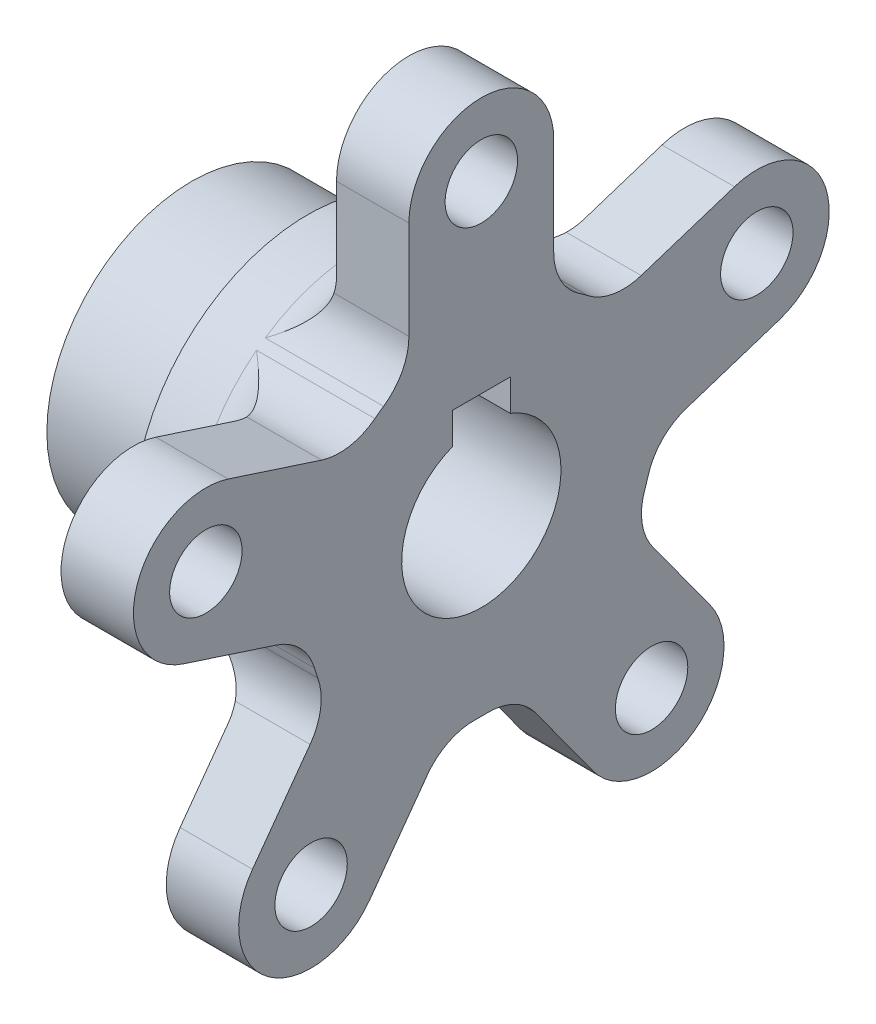
from build123d import *

# Parameters (mm, degrees)
SKETCH1_R                = 10
BOSS_EXTRUDE2_DEPTH      = 20
SKETCH5_R                = 12
BOSS_EXTRUDE3_DEPTH      = 12
BOSS_EXTRUDE4_DEPTH      = 5
FILLET2_R                = 3.175
F_5_0_5_DIAMETER_HOLE1_D = 5
FILLET1_START            = 15.0000001
FILLET1_DEPTH            = 4.9999999
FILLET1_START_2          = 11.8249999
FILLET1_2_DEPTH          = 3.1750001
CIRPATTERN6_START        = 11.8249999
CIRPATTERN6_OUTLINE_R    = 2.5
CIRPATTERN6_DEPTH        = 8.1750001
SKETCH2_R                = 5.5
SHAFT_HOLE_DEPTH         = 41.025175904
SKETCH3_W                = 4
SKETCH3_H                = 3.6
KEYWAY_DEPTH             = 41.025175904


with BuildPart() as part:
    # Sketch1 → Boss-Extrude2 (new body)
    with BuildSketch(Plane(origin=(0, 0, 0), x_dir=(0, 0, -1), z_dir=(1, 0, 0))):
        Circle(SKETCH1_R)
    extrude(amount=BOSS_EXTRUDE2_DEPTH)

    # Sketch5 → Boss-Extrude3 (add)
    with BuildSketch(Plane.ZY.offset(-20)):
        Circle(SKETCH5_R)
    extrude(amount=BOSS_EXTRUDE3_DEPTH)

    # Sketch6 → Boss-Extrude4 (add)
    with BuildSketch(Plane(origin=(20, 0, 0), x_dir=(0, 0, -1), z_dir=(1, 0, 0))):
        with BuildLine():
            Line((-5, 20), (-5, 0))
            Line((-5, 0), (5, 0))
            Line((5, 0), (5, 20))
            ThreePointArc((5, 20), (0, 25), (-5, 20))
        make_face()
    extrude(amount=-BOSS_EXTRUDE4_DEPTH)

    # Fillet2
    fillet2_edges = [part.edges().sort_by_distance(p)[0] for p in [
        (15, 12, 0),
    ]]
    fillet(fillet2_edges, radius=FILLET2_R)

    # Ø5.0 (5) Diameter Hole1 (through all)
    with Locations(Plane(origin=(20, 0, 0), x_dir=(0, 0, -1), z_dir=(1, 0, 0))):
        with Locations((0, 20)):
            Hole(F_5_0_5_DIAMETER_HOLE1_D / 2)

    # Fillet1: read off the stored shape, not the designer's step
    # Fillet1 outline → Fillet1 (add)
    with BuildSketch(Plane.YZ.offset(FILLET1_START)):
        with BuildLine():
            ThreePointArc((9.921567416, -6.75), (11.357927862, -5.464466094), (13.228756555, -5))
            Line((13.228756555, -5), (10.908712115, -5))
            ThreePointArc((10.908712115, -5), (10.451830526, -5.895696622), (9.921567416, -6.75))
        make_face()
        with BuildLine():
            ThreePointArc((13.228756555, 5), (11.357927862, 5.464466094), (9.921567416, 6.75))
            ThreePointArc((9.921567416, 6.75), (10.451830526, 5.895696622), (10.908712115, 5))
            Line((10.908712115, 5), (13.228756555, 5))
        make_face()
    extrude(amount=FILLET1_DEPTH)

    # Fillet1 2 outline → Fillet1 2 (add)
    with BuildSketch(Plane.YZ.offset(FILLET1_START_2)):
        with BuildLine():
            ThreePointArc((9.921567416, -6.75), (11.357927862, -5.464466094), (13.228756555, -5))
            Line((13.228756555, -5), (10.908712115, -5))
            ThreePointArc((10.908712115, -5), (10.451830526, -5.895696622), (9.921567416, -6.75))
        make_face()
        with BuildLine():
            ThreePointArc((13.228756555, 5), (11.357927862, 5.464466094), (9.921567416, 6.75))
            ThreePointArc((9.921567416, 6.75), (10.451830526, 5.895696622), (10.908712115, 5))
            Line((10.908712115, 5), (13.228756555, 5))
        make_face()
    extrude(amount=FILLET1_2_DEPTH)

    # Fillet1 3 outline → Fillet1 3 (revolve, cut)
    with BuildSketch(Plane.YX):
        with BuildLine():
            Line((15.175, 11.8249999), (15.175, 15))
            ThreePointArc((15.175, 15), (12.92993597, 14.07006403), (12, 11.825))
            Line((12, 11.825), (15.175, 11.8249999))
        make_face()
    revolve(axis=Axis((0, 0, 0), (1, 0, 0)), mode=Mode.SUBTRACT)

    # CirPattern6: read off the stored shape, not the designer's step
    # CirPattern6 outline → CirPattern6 (add)
    # profile 1 of 4: a face of its own
    with BuildSketch(Plane.YZ.offset(CIRPATTERN6_START)):
        with BuildLine():
            Line((8.843193172, 11.036210153), (10.935622469, 17.476045354))
            ThreePointArc((10.935622469, 17.476045354), (7.725424859, 23.776412907), (1.425057306, 20.566215298))
            Line((1.425057306, 20.566215298), (-0.667371991, 14.126380096))
            ThreePointArc((-0.667371991, 14.126380096), (-1.687223357, 12.490644193), (-3.353698542, 11.521836055))
            ThreePointArc((-3.353698542, 11.521836055), (3.708203933, 11.412678195), (9.485564428, 7.350106631))
            ThreePointArc((9.485564428, 7.350106631), (8.706808817, 9.113418416), (8.843193172, 11.036210153))
        make_face()
        with Locations((6.180339887, 19.021130326)):
            Circle(CIRPATTERN6_OUTLINE_R, mode=Mode.SUBTRACT)
    # profile 2 of 4: a face of its own
    with BuildSketch(Plane.YZ.offset(CIRPATTERN6_START)):
        with BuildLine():
            ThreePointArc((-11.994267104, 0.370886295), (-9.708203933, 7.053423027), (-4.059166198, 11.292615719))
            ThreePointArc((-4.059166198, 11.292615719), (-5.976824079, 11.096868429), (-7.763362606, 11.820752981))
            Line((-7.763362606, 11.820752981), (-13.241413626, 15.800790018))
            ThreePointArc((-13.241413626, 15.800790018), (-20.225424859, 14.694631307), (-19.119266149, 7.710620074))
            Line((-19.119266149, 7.710620074), (-13.641215129, 3.730583038))
            ThreePointArc((-13.641215129, 3.730583038), (-12.400689243, 2.255176559), (-11.994267104, 0.370886295))
        make_face()
        with Locations((-16.180339887, 11.755705046)):
            Circle(CIRPATTERN6_OUTLINE_R, mode=Mode.SUBTRACT)
    # profile 3 of 4: a face of its own
    with BuildSketch(Plane.YZ.offset(CIRPATTERN6_START)):
        with BuildLine():
            ThreePointArc((8.843193172, -11.036210153), (8.706808817, -9.113418416), (9.485564428, -7.350106631))
            ThreePointArc((9.485564428, -7.350106631), (3.708203933, -11.412678195), (-3.353698542, -11.521836055))
            ThreePointArc((-3.353698542, -11.521836055), (-1.687223357, -12.490644193), (-0.667371991, -14.126380096))
            Line((-0.667371991, -14.126380096), (1.425057306, -20.566215298))
            ThreePointArc((1.425057306, -20.566215298), (7.725424859, -23.776412907), (10.935622469, -17.476045354))
            Line((10.935622469, -17.476045354), (8.843193172, -11.036210153))
        make_face()
        with Locations((6.180339887, -19.021130326)):
            Circle(CIRPATTERN6_OUTLINE_R, mode=Mode.SUBTRACT)
    # profile 4 of 4: a face of its own
    with BuildSketch(Plane.YZ.offset(CIRPATTERN6_START)):
        with BuildLine():
            ThreePointArc((-4.059166198, -11.292615719), (-9.708203933, -7.053423027), (-11.994267104, -0.370886295))
            ThreePointArc((-11.994267104, -0.370886295), (-12.400689243, -2.255176559), (-13.641215129, -3.730583038))
            Line((-13.641215129, -3.730583038), (-19.119266149, -7.710620074))
            ThreePointArc((-19.119266149, -7.710620074), (-20.225424859, -14.694631307), (-13.241413626, -15.800790018))
            Line((-13.241413626, -15.800790018), (-7.763362606, -11.820752981))
            ThreePointArc((-7.763362606, -11.820752981), (-5.976824079, -11.096868429), (-4.059166198, -11.292615719))
        make_face()
        with Locations((-16.180339887, -11.755705046)):
            Circle(CIRPATTERN6_OUTLINE_R, mode=Mode.SUBTRACT)
    extrude(amount=CIRPATTERN6_DEPTH)

    # CirPattern6 2 outline → CirPattern6 2 (revolve, cut)
    with BuildSketch(Plane.YX):
        with BuildLine():
            Line((25, 15), (15.175, 15))
            ThreePointArc((15.175, 15), (12.92993597, 14.07006403), (12, 11.825))
            Line((12, 11.825), (25, 11.8249999))
            Line((25, 11.8249999), (25, 15))
        make_face()
    revolve(axis=Axis((0, 0, 0), (1, 0, 0)), mode=Mode.SUBTRACT)

    # Sketch2 → Shaft hole (cut, through all)
    with BuildSketch(Plane.ZY):
        Circle(SKETCH2_R)
    extrude(amount=-SHAFT_HOLE_DEPTH, mode=Mode.SUBTRACT)

    # Sketch3 → Keyway (cut, through all)
    with BuildSketch(Plane.ZY):
        with Locations((0, 5.5)):
            Rectangle(SKETCH3_W, SKETCH3_H)
    extrude(amount=-KEYWAY_DEPTH, mode=Mode.SUBTRACT)


solid = part.part
